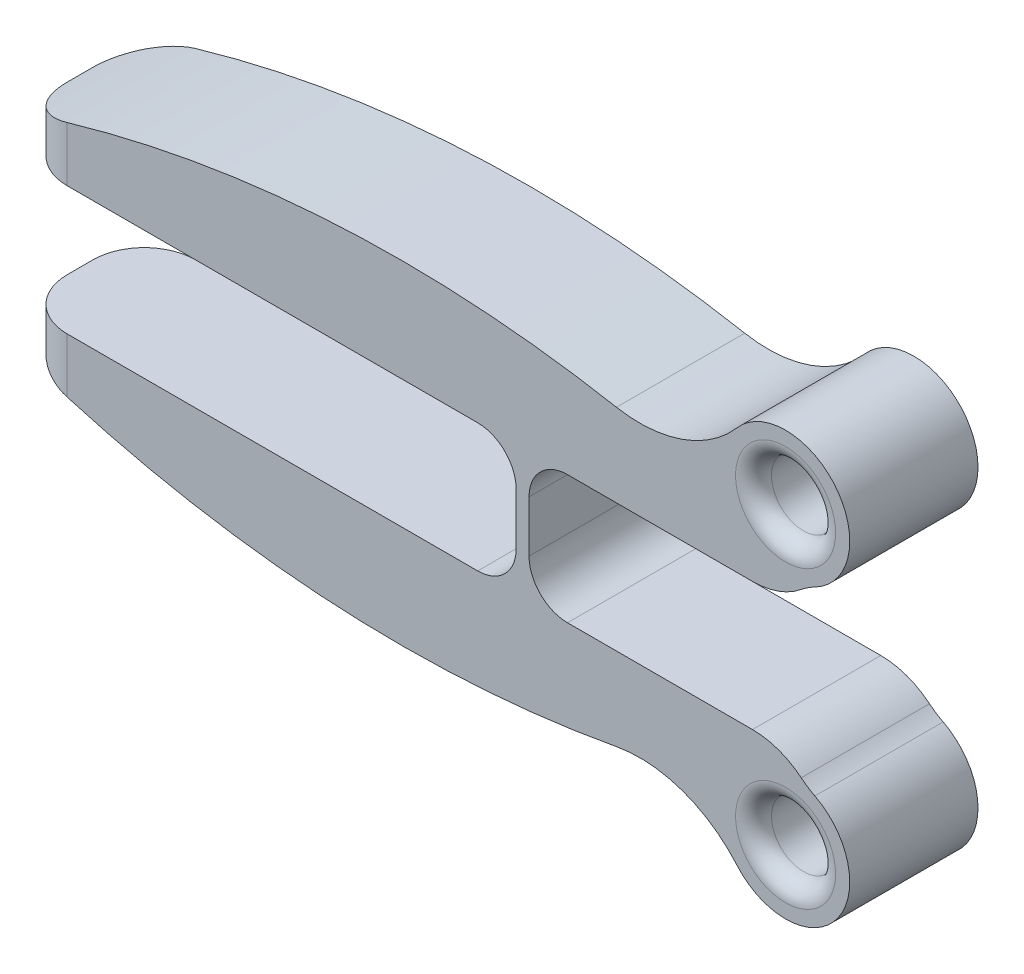
from build123d import *

# Parameters (mm, degrees)
SKETCH1_R           = 1.25
BOSS_EXTRUDE1_DEPTH = 5
FILLET3_R           = 2
FILLET4_R           = 3
FILLET5_R           = 5
FILLET6_R           = 1.5
FILLET8_R           = 0.7
FILLET9_R           = 3


with BuildPart() as part:
    # Sketch1 → Boss-Extrude1 (new body)
    with BuildSketch(Plane.XY):
        with BuildLine():
            Line((10, -0.609130042), (10, 0.141993323))
            ThreePointArc((10, 0.141993323), (11.352749323, 4.744389401), (7.724788103, 1.605937907))
            ThreePointArc((7.724788103, 1.605937907), (-6.192467122, 3.375494669), (-20, 0.890869958))
            Line((-20, 0.890869958), (-20, -0.609130042))
            Line((-20, -0.609130042), (-0.5, -0.609130042))
            Line((-0.5, -0.609130042), (-0.5, -3.109130042))
            Line((-0.5, -3.109130042), (0, -3.109130042))
            Line((0, -3.109130042), (0, -0.609130042))
            Line((0, -0.609130042), (10, -0.609130042))
        make_face()
        with Locations((10, 2.641993323)):
            Circle(SKETCH1_R, mode=Mode.SUBTRACT)
    extrude(amount=BOSS_EXTRUDE1_DEPTH)

    # Fillet3
    fillet3_edges = [part.edges().sort_by_distance(p)[0] for p in [
        (-20, 0.140869958, 0),
        (-20, 0.140869958, 5),
    ]]
    fillet(fillet3_edges, radius=FILLET3_R)

    # Fillet4
    # the kernel refuses this fillet: 3 mm, written as the material it adds along each edge
    with BuildSketch(Plane(origin=(10, 0.141993323, 0), x_dir=(0.9720485785633484, 0.23477981368289305, 0), z_dir=(0, 0, 1))) as fillet4_piece_1:
        with BuildLine():
            CenterArc((1.878238509, -2.916145736), FILLET4_R, 103.578643904, 29.646140471)
            Line((-0.176348604, -0.730128399), (-0.217440346, -0.686408053))
            ThreePointArc((-0.217440346, -0.686408053), (-0.146497217, -0.350977411), (-0.058322915, 0.014086789))
            Line((-0.058322915, 0.014086789), (0.014086789, 0.058322915))
            ThreePointArc((0.014086789, 0.058322915), (0.586949534, -0.009878554), (1.15981228, 0.058322915))
            Line((1.15981228, 0.058322915), (1.173899068, 0))
        make_face()
    extrude(amount=5)

    # Fillet5
    fillet5_edges = [part.edges().sort_by_distance(p)[0] for p in [
        (7.724788103, 1.605937907, 2.5),
    ]]
    fillet(fillet5_edges, radius=FILLET5_R)

    # Mirror2: part across plane


with BuildPart() as part_1:
    add(part.part)
    add(part.part.mirror(Plane(origin=(0, -3.109130042, 0), x_dir=(0, 0, 1), z_dir=(0, -1, 0))))

    # Fillet6
    fillet6_edges = [part_1.edges().sort_by_distance(p)[0] for p in [
        (0, -0.609130042, 2.5),
        (-0.5, -0.609130042, 2.5),
        (-0.5, -5.609130042, 2.5),
        (0, -5.609130042, 2.5),
    ]]
    fillet(fillet6_edges, radius=FILLET6_R)

    # Fillet8
    fillet8_edges = [part_1.edges().sort_by_distance(p)[0] for p in [
        (8.75, 2.641993323, 5),
        (8.75, 2.641993323, 0),
        (8.75, -8.860253407, 5),
        (8.75, -8.860253407, 0),
    ]]
    fillet(fillet8_edges, radius=FILLET8_R)

    # Fillet9
    fillet9_edges = [part_1.edges().sort_by_distance(p)[0] for p in [
        (10, -0.609130042, 2.5),
        (10, -5.609130042, 2.5),
    ]]
    fillet(fillet9_edges, radius=FILLET9_R)


solid = part_1.part
